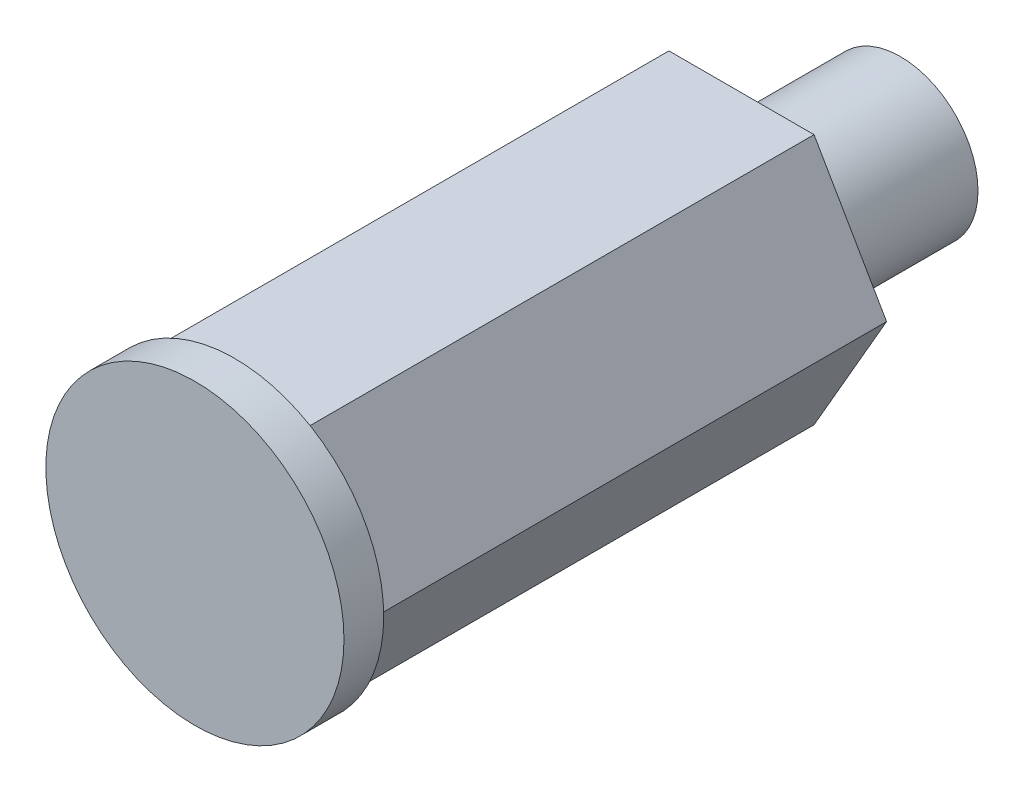
from build123d import *

# Parameters (mm, degrees)
SKETCH1_R           = 3.9
BOSS_EXTRUDE1_DEPTH = 8
BOSS_EXTRUDE2_DEPTH = 25.5
SKETCH3_R           = 7.5
BOSS_EXTRUDE3_DEPTH = 2


with BuildPart() as part:
    # Sketch1 → Boss-Extrude1 (new body)
    with BuildSketch(Plane.XY):
        Circle(SKETCH1_R)
        with BuildLine():
            Line((-1.944164345, -2.015), (-1.944164345, 2.015))
            ThreePointArc((-1.944164345, 2.015), (0, 2.8), (1.944164345, 2.015))
            Line((1.944164345, 2.015), (1.944164345, -2.015))
            ThreePointArc((1.944164345, -2.015), (0, -2.8), (-1.944164345, -2.015))
        make_face(mode=Mode.SUBTRACT)
    extrude(amount=BOSS_EXTRUDE1_DEPTH)

    # Sketch2 → Boss-Extrude2 (add)
    with BuildSketch(Plane.XY.offset(8)):
        Polygon((3.65, 6.321985448), (-3.65, 6.321985448), (-7.3, 0), (-3.65, -6.321985448), (3.65, -6.321985448), (7.3, 0), align=None)
    extrude(amount=BOSS_EXTRUDE2_DEPTH)

    # Sketch3 → Boss-Extrude3 (add)
    with BuildSketch(Plane.XY.offset(33.5)):
        Circle(SKETCH3_R)
    extrude(amount=BOSS_EXTRUDE3_DEPTH)


solid = part.part
